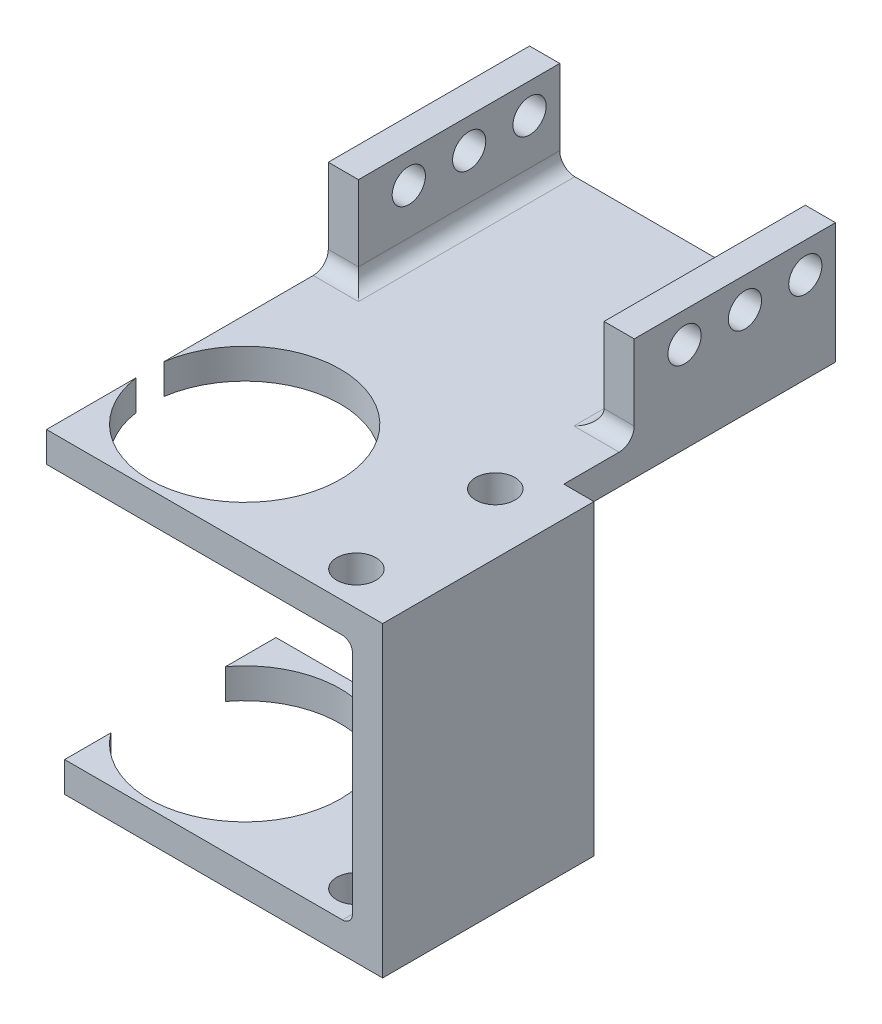
from build123d import *

# Parameters (mm, degrees)
BOSS_EXTRUDE1_DEPTH              = 27
BOSS_EXTRUDE2_DEPTH              = 21
BOSS_EXTRUDE3_DEPTH              = 21
CUT_EXTRUDE1_DEPTH               = 51.918952263
CUT_EXTRUDE1_DEPTH_BACK          = 51.918952263
SKETCH6_R                        = 9.5
M3_5_CLEARANCE_HOLE1_D           = 3.9
M3_5_CLEARANCE_HOLE1_CSINK_D     = 3.95
M3_5_CLEARANCE_HOLE1_CSINK_ANGLE = 90
FILLET1_R                        = 1
RIB16_REACH                      = 75.026
SKETCH14_WALL_W                  = 160.663218032
SKETCH14_WALL_H                  = 2
RIB17_REACH                      = 75.026
SKETCH16_WALL_W                  = 160.663218032
SKETCH16_WALL_H                  = 2
FILLET2_R                        = 1.5
SKETCH18_R                       = 1.65
SKETCH18_W                       = 7
SKETCH18_H                       = 9
CUT_EXTRUDE2_DEPTH               = 75.194406797
FILLET3_R                        = 1.5


with BuildPart() as part:
    # Sketch1 → Boss-Extrude1 (new body)
    with BuildSketch(Plane.XY):
        Polygon((14.42095576, -21), (11.42095576, -21), (11.42095576, -30), (-12.97904424, -30), (-12.97904424, -21), (-15.97904424, -21), (-15.97904424, -33), (14.42095576, -33), align=None)
    extrude(amount=-BOSS_EXTRUDE1_DEPTH)

    # Sketch1<3> → Boss-Extrude2 (add)
    with BuildSketch(Plane.XY):
        Polygon((14.42095576, -30), (11.42095576, -30), (-12.97904424, -30), (-15.97904424, -30), (-15.97904424, -33), (14.377296505, -33), (14.42095576, -33), align=None)
    extrude(amount=BOSS_EXTRUDE2_DEPTH)

    # Sketch5 → Boss-Extrude3 (add)
    with BuildSketch(Plane.XY.offset(21)):
        Polygon((14.42095576, -30), (17.42095576, -30), (17.42095576, -60.5), (-14.17601239, -60.5), (-14.17601239, -57.5), (14.42095576, -57.5), align=None)
    extrude(amount=-BOSS_EXTRUDE3_DEPTH)

    # Sketch6 → Cut-Extrude1 (cut, two sides: drawn at the far end of the back side and taken through both)
    with BuildSketch(Plane.XZ.offset(60.5).offset(-CUT_EXTRUDE1_DEPTH_BACK)):
        with Locations((-6.57904424, 10.707170057)):
            Circle(SKETCH6_R)
    extrude(amount=CUT_EXTRUDE1_DEPTH + CUT_EXTRUDE1_DEPTH_BACK, mode=Mode.SUBTRACT)

    # M3.5 Clearance Hole1 (through all)
    with Locations(Plane(origin=(0, -60.5, 0), x_dir=(-1, 0, 0), z_dir=(0, -1, 0))):
        with Locations((-11.42095576, -17.607170057), (-11.42095576, -3.807170057)):
            CounterSinkHole(M3_5_CLEARANCE_HOLE1_D / 2, M3_5_CLEARANCE_HOLE1_CSINK_D / 2, counter_sink_angle=M3_5_CLEARANCE_HOLE1_CSINK_ANGLE)

    # Fillet1
    fillet1_edges = [part.edges().sort_by_distance(p)[0] for p in [
        (14.42095576, -33, 10.5),
        (14.42095576, -57.5, 10.5),
    ]]
    fillet(fillet1_edges, radius=FILLET1_R)

    # Sketch14 wall → Rib16 (add, up to next)
    with BuildSketch(Plane(origin=(12.92095576, -39.125, 10), x_dir=(-0.237868729379, 0.971297311632, 0), z_dir=(0.971297311632, 0.237868729379, 0)), mode=Mode.PRIVATE) as rib16_sk1:
        Rectangle(SKETCH14_WALL_W, SKETCH14_WALL_H)
    rib16_tool1 = extrude(rib16_sk1.sketch, amount=RIB16_REACH, mode=Mode.PRIVATE) - part.part
    add(rib16_tool1.solids().sort_by_distance((12.92095576, -39.125, 10))[0])

    # Sketch16 wall → Rib17 (add, up to next)
    with BuildSketch(Plane(origin=(12.92095576, -51.375, 10), x_dir=(-0.237868729379, -0.971297311632, 0), z_dir=(0.971297311632, -0.237868729379, 0)), mode=Mode.PRIVATE) as rib17_sk1:
        Rectangle(SKETCH16_WALL_W, SKETCH16_WALL_H)
    rib17_tool1 = extrude(rib17_sk1.sketch, amount=RIB17_REACH, mode=Mode.PRIVATE) - part.part
    add(rib17_tool1.solids().sort_by_distance((12.92095576, -51.375, 10))[0])

    # Fillet2
    fillet2_edges = [part.edges().sort_by_distance(p)[0] for p in [
        (11.42095576, -30, -13.5),
        (-12.97904424, -30, -13.5),
    ]]
    fillet(fillet2_edges, radius=FILLET2_R)

    # Sketch18 → Cut-Extrude2 (cut, through all)
    with BuildSketch(Plane.ZY.offset(15.97904424)):
        with Locations((-18, -24)):
            Circle(SKETCH18_R)
        with Locations((-12, -24)):
            Circle(SKETCH18_R)
        with Locations((-24, -24)):
            Circle(SKETCH18_R)
        with Locations((-3.5, -25.5)):
            Rectangle(SKETCH18_W, SKETCH18_H)
    extrude(amount=-CUT_EXTRUDE2_DEPTH, mode=Mode.SUBTRACT)

    # Fillet3
    fillet3_edges = [part.edges().sort_by_distance(p)[0] for p in [
        (12.17095576, -30, -7),
        (-13.72904424, -30, -7),
    ]]
    fillet(fillet3_edges, radius=FILLET3_R)


solid = part.part
